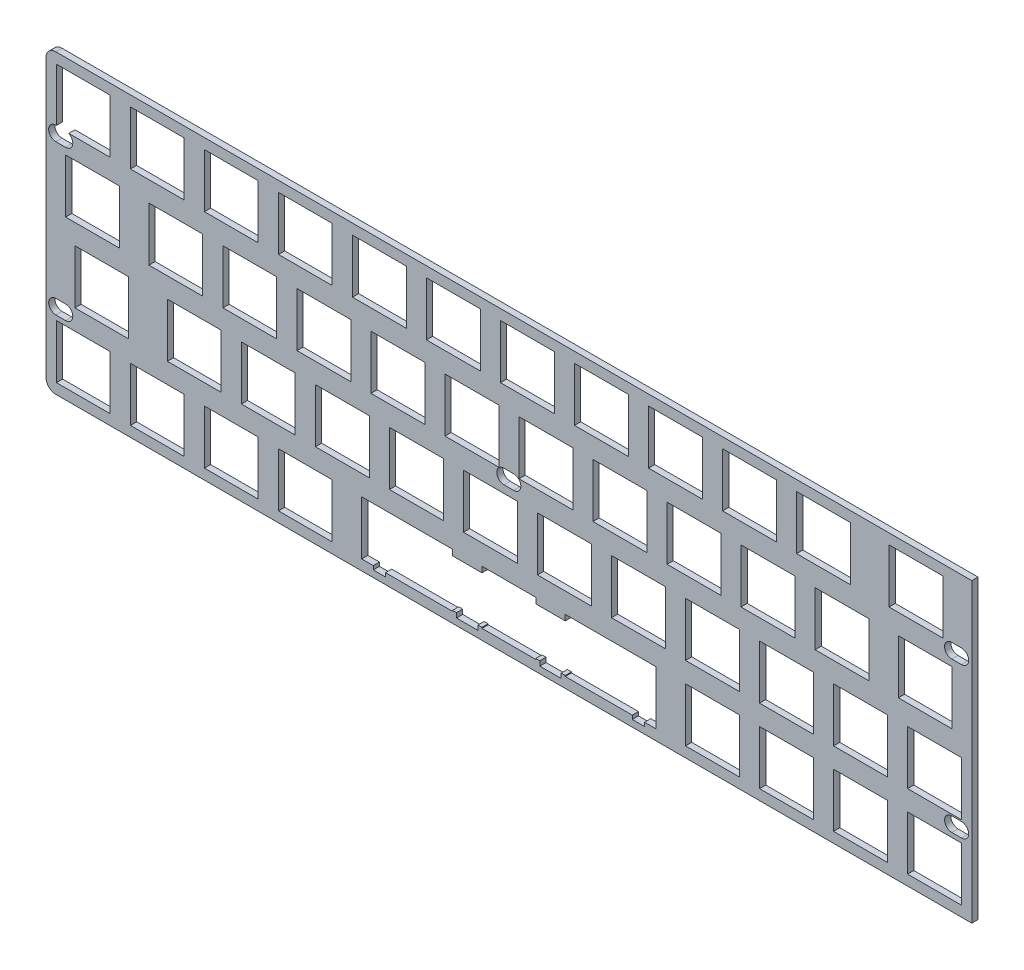
from build123d import *

# Parameters (mm, degrees)
MODEL_W             = 238.2749154
MODEL_H             = 76.350013
MODEL_W_2           = 13.849
MODEL_H_2           = 13.84926
MODEL_W_3           = 13.8491
MODEL_W_4           = 13.84934
MODEL_H_3           = 13.8492
MODEL_W_5           = 13.85
MODEL_W_6           = 13.8504
MODEL_W_7           = 13.85071
MODEL_W_8           = 13.851
MODEL_H_4           = 13.849
MODEL_W_9           = 13.8505
MODEL_W_10          = 13.84928
BOSS_EXTRUDE1_DEPTH = 1.6
FILLET1_R           = 2.5
CUT_EXTRUDE1_DEPTH  = 1.6


with BuildPart() as part:
    # Model → Boss-Extrude1 (new body)
    with BuildSketch(Plane.XY):
        with Locations((119.2325423, 38.2824935)):
            Rectangle(MODEL_W, MODEL_H)
        Polygon((81.3513, 16.6329), (81.3513, 2.78364), (84.3248, 2.78364), (84.3248, 1.8135), (87.4751, 1.8135), (87.4751, 2.78364), (104.725, 2.78364), (104.725, 3.01377), (105.756, 3.01377), (105.756, 1.8135), (111.275, 1.8135), (111.275, 3.01377), (112.306, 3.01377), (112.306, 2.78364), (126.157, 2.78364), (126.157, 3.01377), (127.187, 3.01377), (127.187, 1.8135), (132.707, 1.8135), (132.707, 3.01377), (133.737, 3.01377), (133.737, 2.78364), (150.987, 2.78364), (150.987, 1.8135), (154.138, 1.8135), (154.138, 2.78364), (157.113, 2.78364), (157.113, 16.6329), (133.737, 16.6329), (133.737, 15.1639), (126.157, 15.1639), (126.157, 16.6329), (112.306, 16.6329), (112.306, 15.1639), (104.725, 15.1639), (104.725, 16.6329), align=None, mode=Mode.SUBTRACT)
        with Locations((228.7695, 9.70827)):
            Rectangle(MODEL_W_2, MODEL_H_2, mode=Mode.SUBTRACT)
        with Locations((209.7195, 9.70827)):
            Rectangle(MODEL_W_2, MODEL_H_2, mode=Mode.SUBTRACT)
        with Locations((190.6695, 9.70827)):
            Rectangle(MODEL_W_2, MODEL_H_2, mode=Mode.SUBTRACT)
        with Locations((171.6195, 9.70827)):
            Rectangle(MODEL_W_2, MODEL_H_2, mode=Mode.SUBTRACT)
        with Locations((66.8445, 9.70827)):
            Rectangle(MODEL_W_2, MODEL_H_2, mode=Mode.SUBTRACT)
        with Locations((47.7945, 9.70827)):
            Rectangle(MODEL_W_2, MODEL_H_2, mode=Mode.SUBTRACT)
        with Locations((28.74445, 9.70827)):
            Rectangle(MODEL_W_3, MODEL_H_2, mode=Mode.SUBTRACT)
        with Locations((9.69453, 9.70827)):
            Rectangle(MODEL_W_4, MODEL_H_2, mode=Mode.SUBTRACT)
        with Locations((228.7695, 28.7582)):
            Rectangle(MODEL_W_2, MODEL_H_3, mode=Mode.SUBTRACT)
        with Locations((209.7195, 28.7582)):
            Rectangle(MODEL_W_2, MODEL_H_3, mode=Mode.SUBTRACT)
        with Locations((190.6695, 28.7582)):
            Rectangle(MODEL_W_2, MODEL_H_3, mode=Mode.SUBTRACT)
        with Locations((171.6195, 28.7582)):
            Rectangle(MODEL_W_2, MODEL_H_3, mode=Mode.SUBTRACT)
        with Locations((152.569, 28.7582)):
            Rectangle(MODEL_W_5, MODEL_H_3, mode=Mode.SUBTRACT)
        with Locations((133.519, 28.7582)):
            Rectangle(MODEL_W_5, MODEL_H_3, mode=Mode.SUBTRACT)
        with Locations((114.469, 28.7582)):
            Rectangle(MODEL_W_5, MODEL_H_3, mode=Mode.SUBTRACT)
        with Locations((95.4188, 28.7582)):
            Rectangle(MODEL_W_6, MODEL_H_3, mode=Mode.SUBTRACT)
        with Locations((76.3695, 28.7582)):
            Rectangle(MODEL_W_2, MODEL_H_3, mode=Mode.SUBTRACT)
        with Locations((57.3195, 28.7582)):
            Rectangle(MODEL_W_2, MODEL_H_3, mode=Mode.SUBTRACT)
        with Locations((38.26945, 28.7582)):
            Rectangle(MODEL_W_3, MODEL_H_3, mode=Mode.SUBTRACT)
        with Locations((14.456345, 28.7582)):
            Rectangle(MODEL_W_7, MODEL_H_3, mode=Mode.SUBTRACT)
        with Locations((226.3875, 47.8083)):
            Rectangle(MODEL_W_8, MODEL_H_4, mode=Mode.SUBTRACT)
        with Locations((204.9565, 47.8083)):
            Rectangle(MODEL_W_8, MODEL_H_4, mode=Mode.SUBTRACT)
        with Locations((185.9065, 47.8083)):
            Rectangle(MODEL_W_8, MODEL_H_4, mode=Mode.SUBTRACT)
        with Locations((166.8565, 47.8083)):
            Rectangle(MODEL_W_8, MODEL_H_4, mode=Mode.SUBTRACT)
        with Locations((147.8065, 47.8083)):
            Rectangle(MODEL_W_8, MODEL_H_4, mode=Mode.SUBTRACT)
        with Locations((128.7565, 47.8083)):
            Rectangle(MODEL_W_8, MODEL_H_4, mode=Mode.SUBTRACT)
        with Locations((109.7065, 47.8083)):
            Rectangle(MODEL_W_8, MODEL_H_4, mode=Mode.SUBTRACT)
        with Locations((90.6563, 47.8083)):
            Rectangle(MODEL_W_6, MODEL_H_4, mode=Mode.SUBTRACT)
        with Locations((71.6063, 47.8083)):
            Rectangle(MODEL_W_6, MODEL_H_4, mode=Mode.SUBTRACT)
        with Locations((52.5563, 47.8083)):
            Rectangle(MODEL_W_6, MODEL_H_4, mode=Mode.SUBTRACT)
        with Locations((33.50625, 47.8083)):
            Rectangle(MODEL_W_9, MODEL_H_4, mode=Mode.SUBTRACT)
        with Locations((12.07576, 47.8083)):
            Rectangle(MODEL_W_10, MODEL_H_4, mode=Mode.SUBTRACT)
        with Locations((224.0065, 66.8583)):
            Rectangle(MODEL_W_8, MODEL_H_4, mode=Mode.SUBTRACT)
        with Locations((200.1945, 66.8583)):
            Rectangle(MODEL_W_2, MODEL_H_4, mode=Mode.SUBTRACT)
        with Locations((181.1445, 66.8583)):
            Rectangle(MODEL_W_2, MODEL_H_4, mode=Mode.SUBTRACT)
        with Locations((162.0945, 66.8583)):
            Rectangle(MODEL_W_2, MODEL_H_4, mode=Mode.SUBTRACT)
        with Locations((143.0445, 66.8583)):
            Rectangle(MODEL_W_2, MODEL_H_4, mode=Mode.SUBTRACT)
        with Locations((123.9945, 66.8583)):
            Rectangle(MODEL_W_2, MODEL_H_4, mode=Mode.SUBTRACT)
        with Locations((104.9445, 66.8583)):
            Rectangle(MODEL_W_2, MODEL_H_4, mode=Mode.SUBTRACT)
        with Locations((85.8945, 66.8583)):
            Rectangle(MODEL_W_2, MODEL_H_4, mode=Mode.SUBTRACT)
        with Locations((66.8445, 66.8583)):
            Rectangle(MODEL_W_2, MODEL_H_4, mode=Mode.SUBTRACT)
        with Locations((47.7945, 66.8583)):
            Rectangle(MODEL_W_2, MODEL_H_4, mode=Mode.SUBTRACT)
        with Locations((28.74445, 66.8583)):
            Rectangle(MODEL_W_3, MODEL_H_4, mode=Mode.SUBTRACT)
        with Locations((9.69453, 66.8583)):
            Rectangle(MODEL_W_4, MODEL_H_4, mode=Mode.SUBTRACT)
    extrude(amount=BOSS_EXTRUDE1_DEPTH)

    # Fillet1
    fillet1_edges = [part.edges().sort_by_distance(p)[0] for p in [
        (0.0950846, 0.107487, 0.8),
        (0.0950846, 76.4575, 0.8),
    ]]
    fillet(fillet1_edges, radius=FILLET1_R)

    # Sketch10 → Cut-Extrude1 (cut)
    with BuildSketch(Plane.XY.offset(1.6)):
        with BuildLine():
            Line((5.1369846, 56.41814), (2.6350846, 56.41814))
            ThreePointArc((2.6350846, 56.41814), (0.7854046, 58.26782), (2.6350846, 60.1175))
            Line((2.6350846, 60.1175), (5.1369846, 60.1175))
            ThreePointArc((5.1369846, 60.1175), (6.9866646, 58.26782), (5.1369846, 56.41814))
        make_face()
        with BuildLine():
            Line((2.6350846, 21.506847), (5.1369846, 21.506847))
            ThreePointArc((5.1369846, 21.506847), (6.9866646, 19.657167), (5.1369846, 17.807487))
            Line((5.1369846, 17.807487), (2.6350846, 17.807487))
            ThreePointArc((2.6350846, 17.807487), (0.7854046, 19.657167), (2.6350846, 21.506847))
        make_face()
        with BuildLine():
            Line((120.46, 37.61814), (117.9581, 37.61814))
            ThreePointArc((117.9581, 37.61814), (116.10842, 39.46782), (117.9581, 41.3175))
            Line((117.9581, 41.3175), (120.46, 41.3175))
            ThreePointArc((120.46, 41.3175), (122.30968, 39.46782), (120.46, 37.61814))
        make_face()
        with BuildLine():
            Line((235.71, 56.41814), (233.2081, 56.41814))
            ThreePointArc((233.2081, 56.41814), (231.35842, 58.26782), (233.2081, 60.1175))
            Line((233.2081, 60.1175), (235.71, 60.1175))
            ThreePointArc((235.71, 60.1175), (237.55968, 58.26782), (235.71, 56.41814))
        make_face()
        with BuildLine():
            Line((235.705791468, 17.74750176), (233.226720632, 17.764890937))
            ThreePointArc((233.226720632, 17.764890937), (231.377476323, 19.615090931), (233.227676318, 21.464335239))
            Line((233.227676318, 21.464335239), (235.73173956, 21.446770756))
            ThreePointArc((235.73173956, 21.446770756), (237.568400012, 19.584162212), (235.705791468, 17.74750176))
        make_face()
    extrude(amount=-CUT_EXTRUDE1_DEPTH, mode=Mode.SUBTRACT)


solid = part.part
